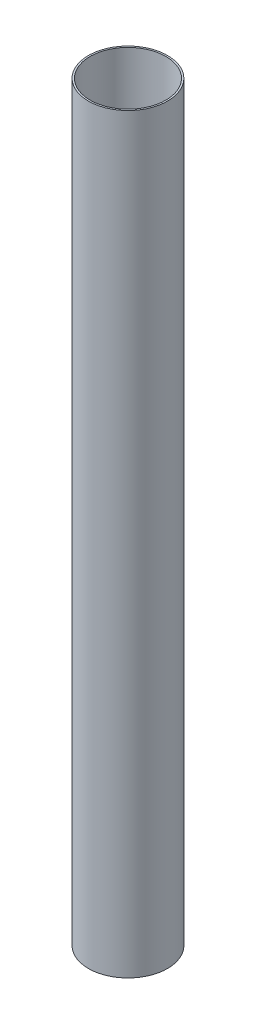
from build123d import *

# Parameters (mm, degrees)
SKETCH1_R           = 304.8
SKETCH1_R_2         = 292.1
BOSS_EXTRUDE1_DEPTH = 5791.2


with BuildPart() as part:
    # Sketch1 → Boss-Extrude1 (new body)
    with BuildSketch(Plane(origin=(0, 0, 0), x_dir=(1, 0, 0), z_dir=(0, 1, 0))):
        Circle(SKETCH1_R)
        Circle(SKETCH1_R_2, mode=Mode.SUBTRACT)
    extrude(amount=BOSS_EXTRUDE1_DEPTH)


solid = part.part
